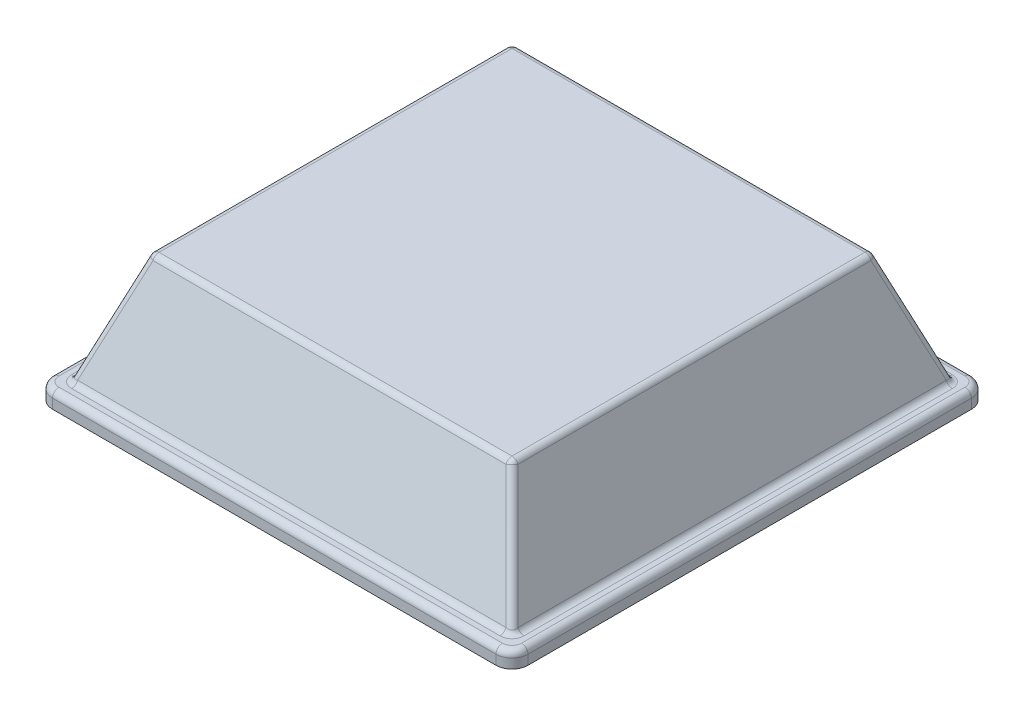
from build123d import *

# Parameters (mm, degrees)
SKETCH2_W           = 10.31875
SKETCH2_H           = 10.31875
BOSS_EXTRUDE1_DEPTH = 0.347265625
SKETCH4_W           = 9.62421875
SKETCH4_H           = 9.62421875
BOSS_EXTRUDE2_DEPTH = 2.430859
BOSS_EXTRUDE2_TAPER = 20
FILLET1_R           = 0.347265625
FILLET2_R           = 0.13890625


with BuildPart() as part:
    # Sketch2 → Boss-Extrude1 (new body)
    with BuildSketch(Plane(origin=(0, 0, 0), x_dir=(1, 0, 0), z_dir=(0, 1, 0))):
        Rectangle(SKETCH2_W, SKETCH2_H)
    extrude(amount=BOSS_EXTRUDE1_DEPTH)

    # Sketch4 → Boss-Extrude2 (add)
    with BuildSketch(Plane(origin=(0, 0.347265625, 0), x_dir=(1, 0, 0), z_dir=(0, 1, 0))):
        Rectangle(SKETCH4_W, SKETCH4_H)
    extrude(amount=BOSS_EXTRUDE2_DEPTH, taper=BOSS_EXTRUDE2_TAPER)

    # Fillet1
    fillet1_edges = [part.edges().sort_by_distance(p)[0] for p in [
        (5.159375, 0.173632812, -5.159375),
        (5.159375, 0.173632812, 5.159375),
        (-5.159375, 0.173632812, 5.159375),
        (-5.159375, 0.173632812, -5.159375),
    ]]
    fillet(fillet1_edges, radius=FILLET1_R)

    # Fillet2
    fillet2_edges = [part.edges().sort_by_distance(p)[0] for p in [
        (0, 0.347265625, -4.812109375),
        (4.369729215, 1.562695125, -4.369729215),
        (-4.812109375, 0.347265625, 0),
        (-4.369729215, 1.562695125, -4.369729215),
        (0, 0.347265625, 4.812109375),
        (-4.369729215, 1.562695125, 4.369729215),
        (4.812109375, 0.347265625, 0),
        (4.369729215, 1.562695125, 4.369729215),
        (0, 2.778124625, -3.927349055),
        (-3.927349055, 2.778124625, 0),
        (0, 2.778124625, 3.927349055),
        (3.927349055, 2.778124625, 0),
        (0, 0.347265625, 5.159375),
        (-5.159375, 0.347265625, 0),
        (0, 0.347265625, -5.159375),
        (5.159375, 0.347265625, 0),
        (5.057663253, 0.347265625, 5.057663253),
        (5.057663253, 0.347265625, -5.057663253),
        (-5.057663253, 0.347265625, -5.057663253),
        (-5.057663253, 0.347265625, 5.057663253),
    ]]
    fillet(fillet2_edges, radius=FILLET2_R)


solid = part.part
